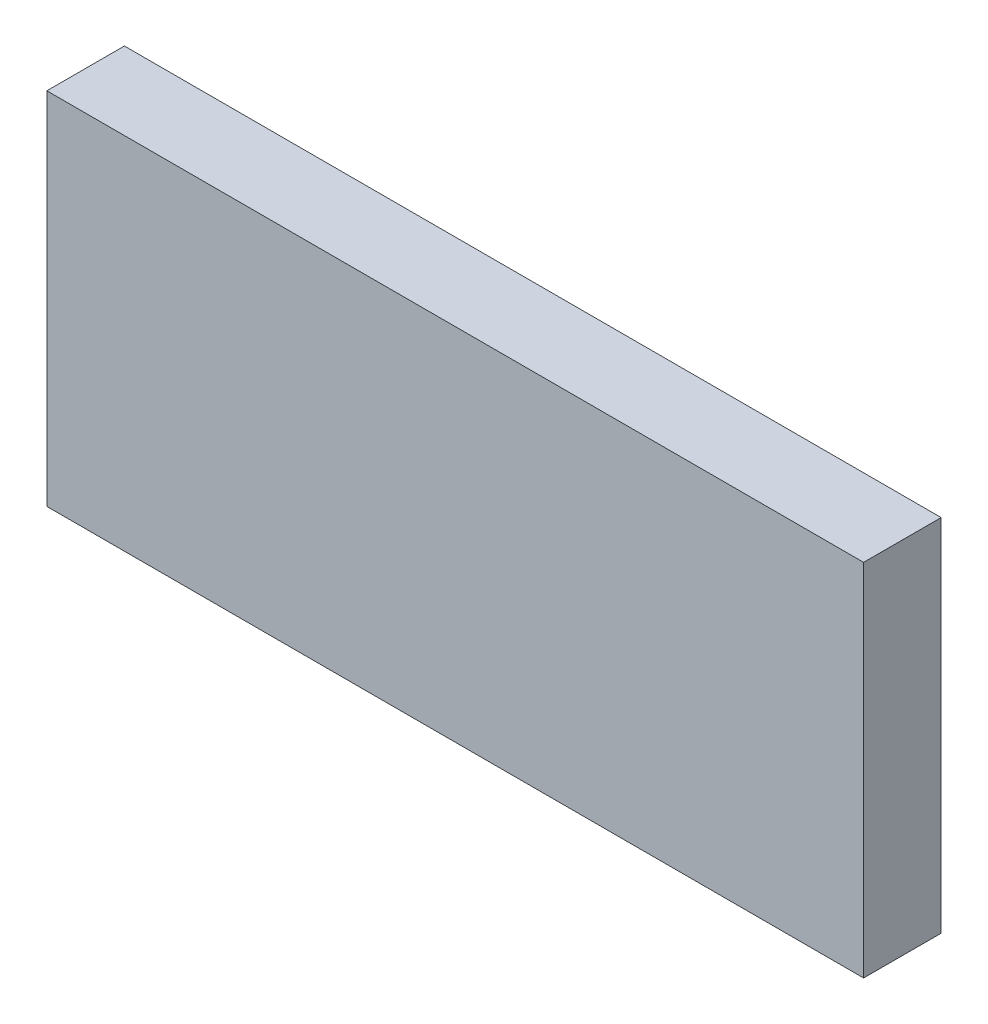
from build123d import *

# Parameters (mm, degrees)
ESQUISSE1_W        = 63.19
ESQUISSE1_H        = 27.85
BOSS_EXTRU_1_DEPTH = 6


with BuildPart() as part:
    # Esquisse1 → Boss.-Extru.1 (new body)
    with BuildSketch(Plane.XY):
        with Locations((-5.107040309, 7.485531136)):
            Rectangle(ESQUISSE1_W, ESQUISSE1_H)
    extrude(amount=BOSS_EXTRU_1_DEPTH)


solid = part.part
